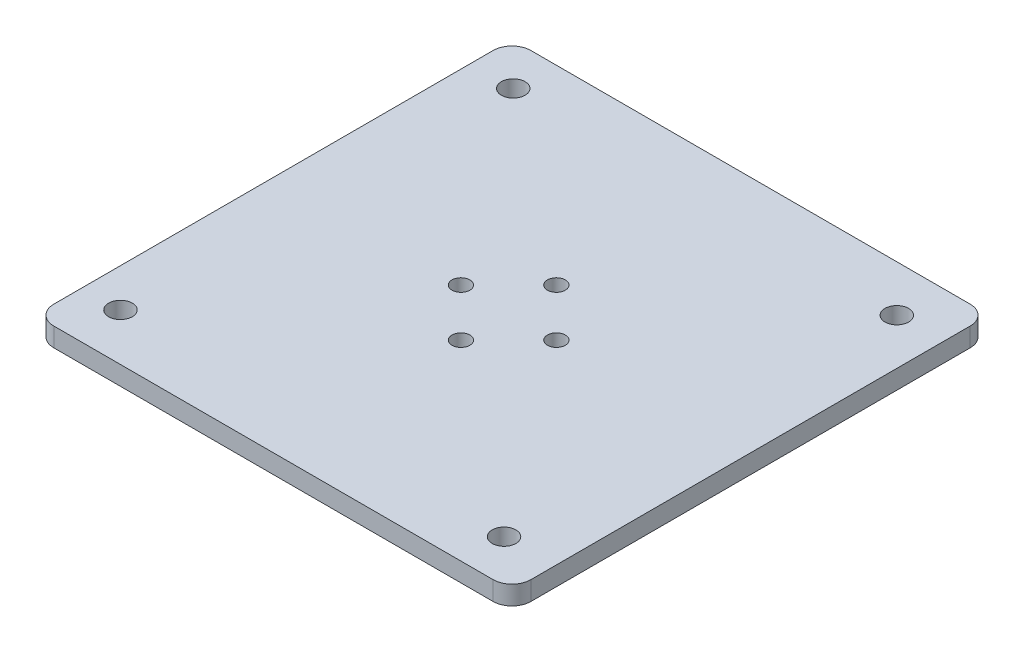
from build123d import *

# Parameters (mm, degrees)
SKETCH1_W           = 80
SKETCH1_H           = 80
BOSS_EXTRUDE1_DEPTH = 3.175
SKETCH16_R          = 1.984375
CUT_EXTRUDE8_DEPTH  = 10
FILLET1_R           = 3.175
SKETCH21_R          = 1.5
CUT_EXTRUDE9_DEPTH  = 10


with BuildPart() as part:
    # Sketch1 → Boss-Extrude1 (new body)
    with BuildSketch(Plane(origin=(0, 0, 0), x_dir=(1, 0, 0), z_dir=(0, 1, 0))):
        Rectangle(SKETCH1_W, SKETCH1_H)
    extrude(amount=BOSS_EXTRUDE1_DEPTH)

    # Sketch16 → Cut-Extrude8 (cut)
    with BuildSketch(Plane(origin=(0, 3.175, 0), x_dir=(1, 0, 0), z_dir=(0, 1, 0))):
        with Locations((-32.800817373, 33.005763026)):
            Circle(SKETCH16_R)
        with Locations((32.282136008, 32.236454615)):
            Circle(SKETCH16_R)
        with Locations((31.512827597, -32.846498766)):
            Circle(SKETCH16_R)
        with Locations((-33.570125785, -32.077190355)):
            Circle(SKETCH16_R)
    extrude(amount=-CUT_EXTRUDE8_DEPTH, mode=Mode.SUBTRACT)

    # Fillet1
    fillet1_edges = [part.edges().sort_by_distance(p)[0] for p in [
        (-40, 1.5875, -40),
        (40, 1.5875, -40),
        (40, 1.5875, 40),
        (-40, 1.5875, 40),
    ]]
    fillet(fillet1_edges, radius=FILLET1_R)

    # Sketch21 → Cut-Extrude9 (cut)
    with BuildSketch(Plane.XZ):
        with Locations((-0.64, 7.92)):
            Circle(SKETCH21_R)
        with Locations((7.36, -0.08)):
            Circle(SKETCH21_R)
        with Locations((-0.64, -8.08)):
            Circle(SKETCH21_R)
        with Locations((-8.64, -0.08)):
            Circle(SKETCH21_R)
    extrude(amount=-CUT_EXTRUDE9_DEPTH, mode=Mode.SUBTRACT)


solid = part.part
